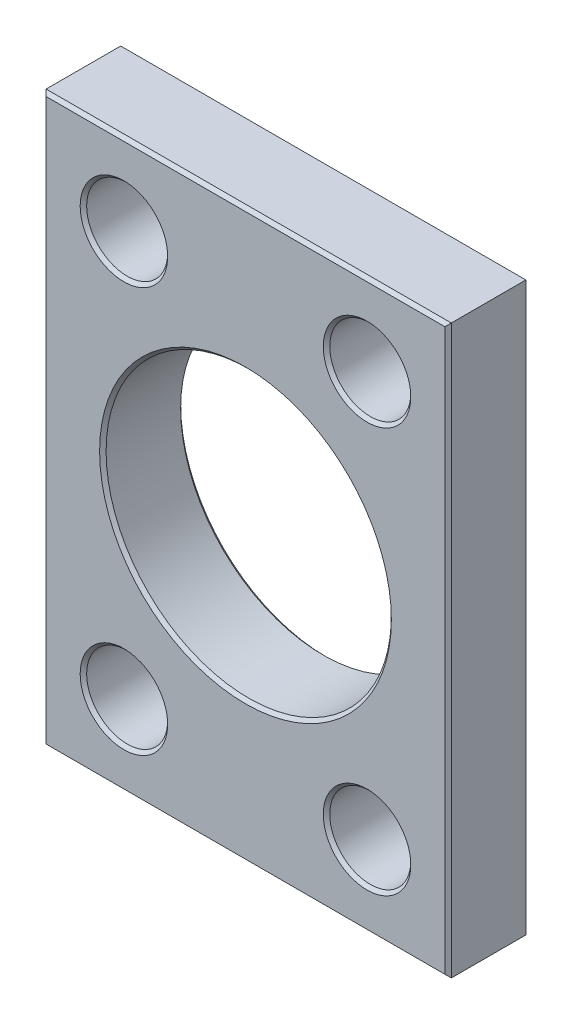
from build123d import *

# Parameters (mm, degrees)
SKETCH1_W           = 31.75
SKETCH1_H           = 44.45
SKETCH1_R           = 3.175
SKETCH1_R_2         = 11.176
BOSS_EXTRUDE1_DEPTH = 6.35
CHAMFER1_SIZE       = 0.254


with BuildPart() as part:
    # Sketch1 → Boss-Extrude1 (new body)
    with BuildSketch(Plane.XY):
        Rectangle(SKETCH1_W, SKETCH1_H)
        with Locations((-9.525, 15.875)):
            Circle(SKETCH1_R, mode=Mode.SUBTRACT)
        with Locations((9.525, 15.875)):
            Circle(SKETCH1_R, mode=Mode.SUBTRACT)
        with Locations((-9.525, -15.875)):
            Circle(SKETCH1_R, mode=Mode.SUBTRACT)
        with Locations((9.525, -15.875)):
            Circle(SKETCH1_R, mode=Mode.SUBTRACT)
        Circle(SKETCH1_R_2, mode=Mode.SUBTRACT)
    extrude(amount=BOSS_EXTRUDE1_DEPTH)

    # Chamfer1
    chamfer1_edges = [part.edges().sort_by_distance(p)[0] for p in [
        (-11.176, 0, 0),
        (-12.7, -15.875, 0),
        (-12.7, 15.875, 0),
        (0, 22.225, 0),
        (-15.875, 0, 0),
        (0, -22.225, 0),
        (15.875, 0, 0),
        (6.35, 15.875, 0),
        (6.35, -15.875, 0),
        (-11.176, 0, 6.35),
        (6.35, -15.875, 6.35),
        (-12.7, -15.875, 6.35),
        (6.35, 15.875, 6.35),
        (-12.7, 15.875, 6.35),
        (0, -22.225, 6.35),
        (-15.875, 0, 6.35),
        (0, 22.225, 6.35),
        (15.875, 0, 6.35),
    ]]
    chamfer(chamfer1_edges, length=CHAMFER1_SIZE)


solid = part.part
